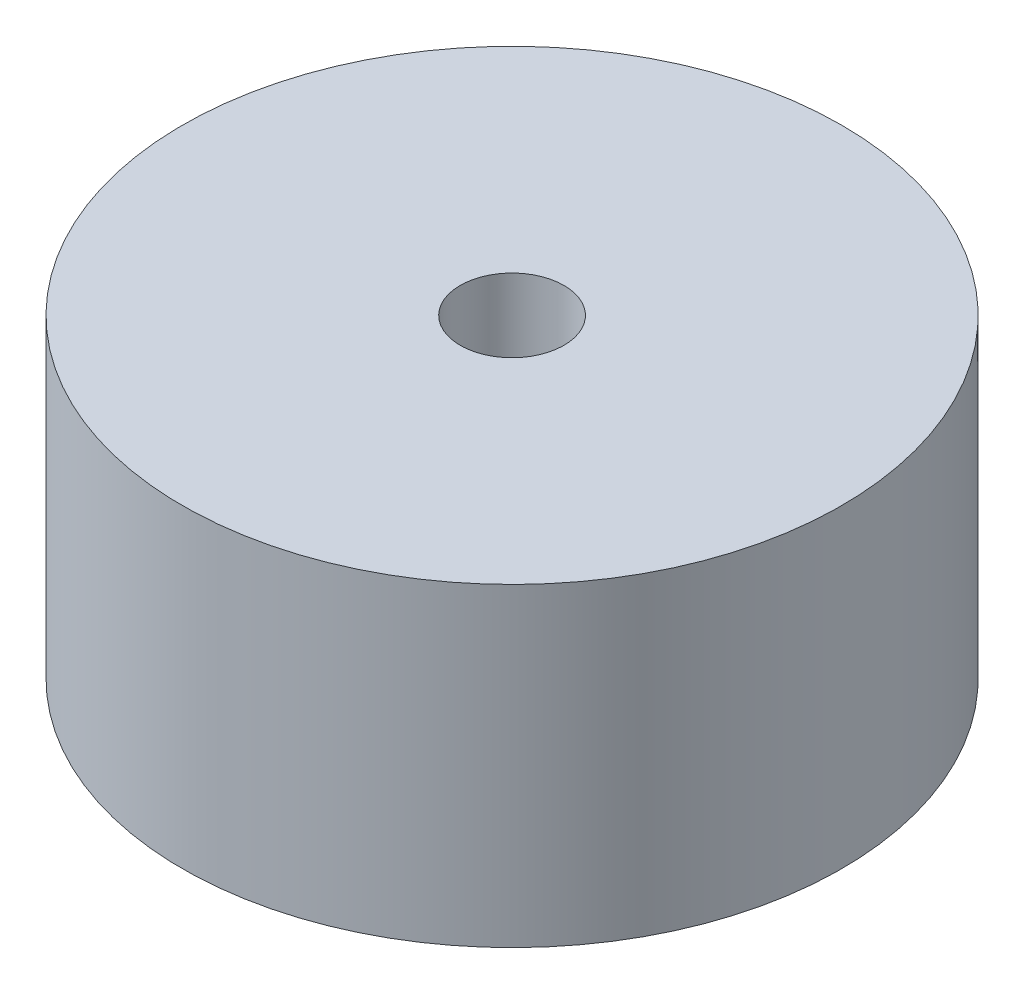
from build123d import *

# Parameters (mm, degrees)
SKETCH1_R           = 31.75
BOSS_EXTRUDE1_DEPTH = 30.3
SKETCH2_R           = 5
CUT_EXTRUDE1_DEPTH  = 55.168394844


with BuildPart() as part:
    # Sketch1 → Boss-Extrude1 (new body)
    with BuildSketch(Plane(origin=(0, 0, 0), x_dir=(1, 0, 0), z_dir=(0, 1, 0))):
        Circle(SKETCH1_R)
    extrude(amount=BOSS_EXTRUDE1_DEPTH)

    # Sketch2 → Cut-Extrude1 (cut, through all)
    with BuildSketch(Plane.XZ):
        Circle(SKETCH2_R)
    extrude(amount=-CUT_EXTRUDE1_DEPTH, mode=Mode.SUBTRACT)


solid = part.part
